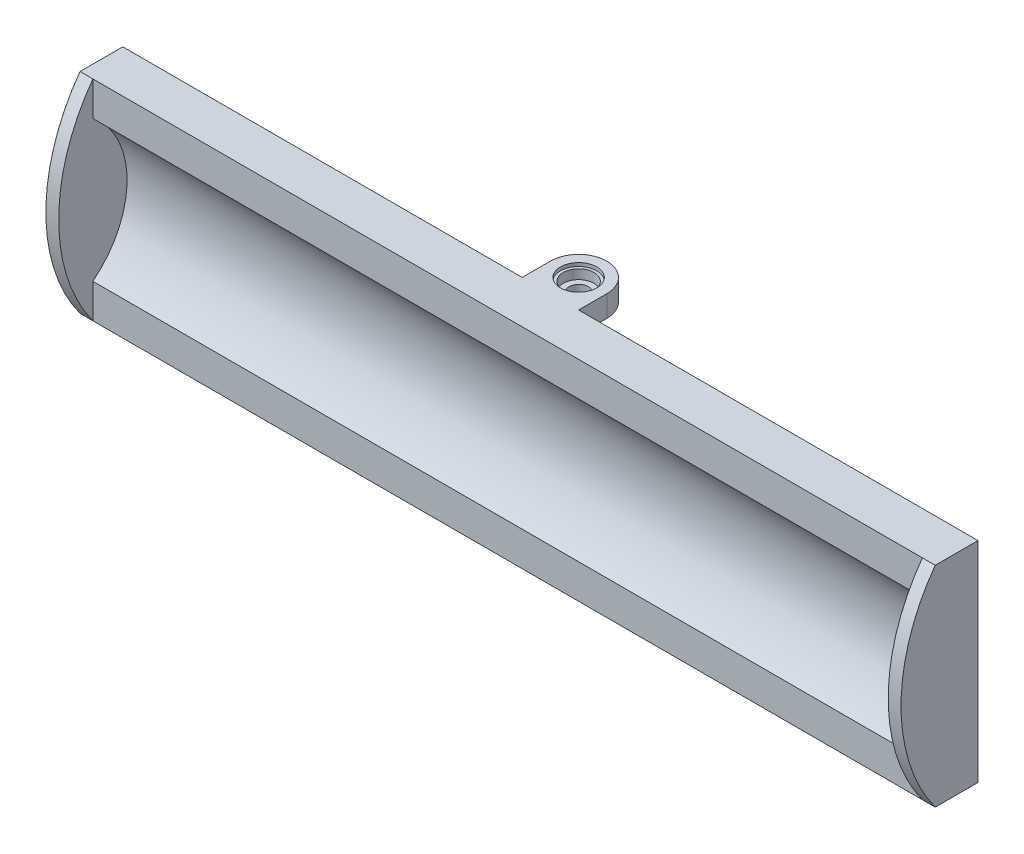
from build123d import *

# Parameters (mm, degrees)
BOSS_EXTRUDE1_DEPTH = 100
SKETCH3_R           = 3.6
BOSS_EXTRUDE2_DEPTH = 5
SKETCH4_R           = 4.25
SKETCH4_R_2         = 3.6
CUT_EXTRUDE1_DEPTH  = 0.8
BOSS_EXTRUDE4_START = -2
SKETCH5_R           = 3.6
SKETCH5_R_2         = 2.25
BOSS_EXTRUDE4_DEPTH = 2
BOSS_EXTRUDE5_START = 7
BOSS_EXTRUDE5_DEPTH = 3
BOSS_EXTRUDE6_DEPTH = 3


with BuildPart() as part:
    # Sketch1 → Boss-Extrude1 (new, symmetric)
    with BuildSketch(Plane.YZ):
        with BuildLine():
            Line((-24.5, 5), (-24.5, -5))
            Line((-24.5, -5), (24.5, -5))
            Line((24.5, -5), (24.5, 5))
            Line((24.5, 5), (16.492422502, 5))
            ThreePointArc((16.492422502, 5), (0, -3), (-16.492422502, 5))
            Line((-16.492422502, 5), (-24.5, 5))
        make_face()
    extrude(amount=BOSS_EXTRUDE1_DEPTH, both=True)

    # Sketch3 → Boss-Extrude2 (add)
    with BuildSketch(Plane.XZ.offset(24.5)):
        with BuildLine():
            ThreePointArc((-6.6, -11.6), (0, -18.2), (6.6, -11.6))
            Line((6.6, -11.6), (6.6, -5))
            Line((6.6, -5), (-6.6, -5))
            Line((-6.6, -5), (-6.6, -11.6))
        make_face()
        with Locations((0, -11.6)):
            Circle(SKETCH3_R, mode=Mode.SUBTRACT)
    boss_extrude2 = extrude(amount=-BOSS_EXTRUDE2_DEPTH)

    # Sketch4 → Cut-Extrude1 (cut)
    with BuildSketch(Plane(origin=(0, -24.5, 0), x_dir=(-1, 0, 0), z_dir=(0, -1, 0))):
        with Locations((0, 11.6)):
            Circle(SKETCH4_R)
        with Locations((0, 11.6)):
            Circle(SKETCH4_R_2, mode=Mode.SUBTRACT)
    cut_extrude1 = extrude(amount=-CUT_EXTRUDE1_DEPTH, mode=Mode.SUBTRACT)

    # Sketch5 → Boss-Extrude4 (add)
    with BuildSketch(Plane(origin=(0, -19.5, 0), x_dir=(-1, 0, 0), z_dir=(0, 1, 0)).offset(BOSS_EXTRUDE4_START)):
        with Locations((0, -11.6)):
            Circle(SKETCH5_R)
        with Locations((0, -11.6)):
            Circle(SKETCH5_R_2, mode=Mode.SUBTRACT)
    boss_extrude4 = extrude(amount=BOSS_EXTRUDE4_DEPTH)

    # Mirror1: Boss-Extrude2, Cut-Extrude1, Boss-Extrude4 across plane
    add(boss_extrude2.mirror(Plane(origin=(0, 0, 0), x_dir=(0, 0, 1), z_dir=(0, -1, 0))))
    add(cut_extrude1.mirror(Plane(origin=(0, 0, 0), x_dir=(0, 0, 1), z_dir=(0, -1, 0))), mode=Mode.SUBTRACT)
    add(boss_extrude4.mirror(Plane(origin=(0, 0, 0), x_dir=(0, 0, 1), z_dir=(0, -1, 0))))

    # Sketch6 → Boss-Extrude5 (add)
    with BuildSketch(Plane(origin=(0, 0, 0), x_dir=(-1, 0, 0), z_dir=(0, -1, 0)).offset(BOSS_EXTRUDE5_START)):
        with BuildLine():
            ThreePointArc((97.75, 11.6), (92.5, 16.85), (87.25, 11.6))
            Line((87.25, 11.6), (87.25, 5))
            Line((87.25, 5), (97.75, 5))
            Line((97.75, 5), (97.75, 11.6))
        make_face()
        with BuildLine():
            ThreePointArc((94.75, 11.6), (92.5, 9.35), (90.25, 11.6))
            ThreePointArc((90.25, 11.6), (92.5, 13.85), (94.75, 11.6))
        make_face(mode=Mode.SUBTRACT)
    boss_extrude5 = extrude(amount=BOSS_EXTRUDE5_DEPTH)

    # Mirror2: Boss-Extrude5 across plane
    add(boss_extrude5.mirror(Plane(origin=(0, 0, 0), x_dir=(0, 0, 1), z_dir=(0, -1, 0))))

    # Sketch7 → Boss-Extrude6 (add)
    with BuildSketch(Plane(origin=(-100, 0, 0), x_dir=(0, -1, 0), z_dir=(-1, 0, 0))):
        with BuildLine():
            ThreePointArc((24.5, 5), (0, 13), (-24.5, 5))
            Line((-24.5, 5), (-24.5, -5))
            Line((-24.5, -5), (24.5, -5))
            Line((24.5, -5), (24.5, 5))
        make_face()
    boss_extrude6 = extrude(amount=-BOSS_EXTRUDE6_DEPTH)

    # Mirror3: Boss-Extrude6 across plane
    add(boss_extrude6.mirror(Plane(origin=(0, 0, 0), x_dir=(0, 0, 1), z_dir=(1, 0, 0))))


solid = part.part
